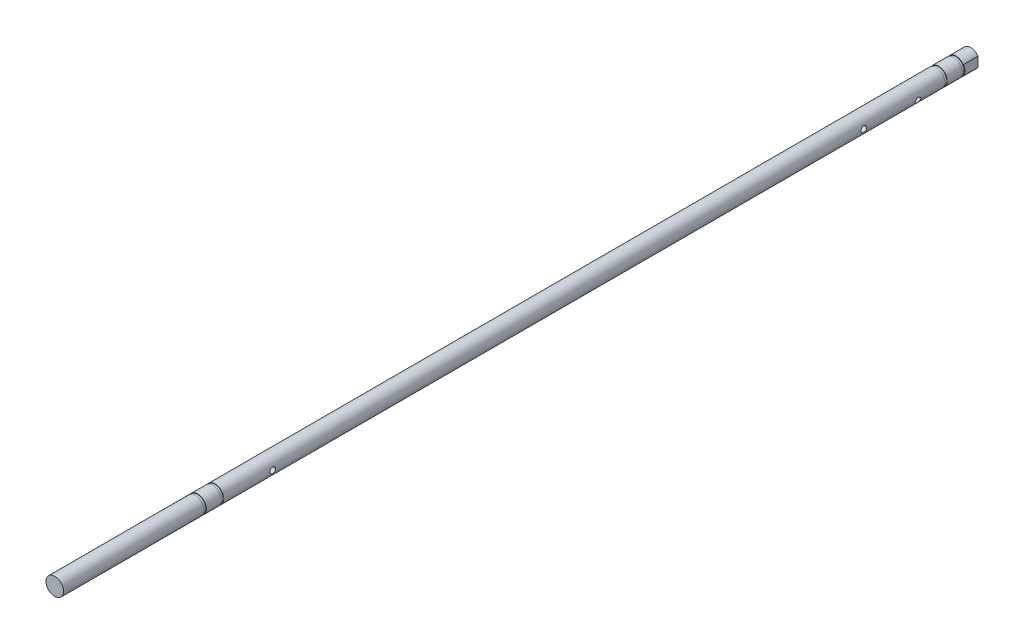
from build123d import *

# Parameters (mm, degrees)
SKETCH1_R                                  = 3
BOSS_EXTRUDE1_DEPTH                        = 275
SKETCH3_W                                  = 0.8
SKETCH3_H                                  = 0.5
CUT_EXTRUDE2_DEPTH                         = 276.032725326
CUT_EXTRUDE2_DEPTH_BACK                    = 276.032725326
SKETCH4_W                                  = 3.470061058
SKETCH4_H                                  = 7
SKETCH4_W_2                                = 2.92528695
CHAMFER1_SIZE                              = 0.3
RETAINING_GROOVES_D5P7_1_START             = 7.05
SKETCH5_R                                  = 2.85
SKETCH5_R_2                                = 2.49
RETAINING_GROOVES_D5P7_1_DEPTH             = 0.8
RETAINING_GROOVES_D5P7_2_START             = 13
SKETCH6_R                                  = 2.85
SKETCH6_R_2                                = 2.49
RETAINING_GROOVES_D5P7_2_DEPTH             = 0.8
RETAINING_GROOVES_D5P7_3_START             = 260.25
SKETCH7_R                                  = 2.85
SKETCH7_R_2                                = 2.49
RETAINING_GROOVES_D5P7_3_DEPTH             = 0.8
RETAINING_GROOVES_D5P7_4_START             = 266.2
SKETCH8_R                                  = 2.85
SKETCH8_R_2                                = 2.49
RETAINING_GROOVES_D5P7_4_DEPTH             = 0.8
TWO_HUB_CROSS_PIN_D2_DEPTH                 = 276.032725326
TWO_HUB_CROSS_PIN_D2_DEPTH_BACK            = 276.032725326
SKETCH9_R                                  = 1
SKETCH10_R                                 = 3.1
REVB_LOWER_SHAFT_NOSE_CLEARANCE_2MM_DEPTH  = 2
REVB_OLDHAM_D2_DRIVE_PIN_CLOCKED_HOLE_OU_W = 1
REVB_OLDHAM_D2_DRIVE_PIN_CLOCKED_HOLE_OU_H = 6.000106441
BENCH_ONEPIECE_SHAFT_END_TO315_START       = 275
SKETCH11_R                                 = 3
BENCH_ONEPIECE_SHAFT_END_TO315_DEPTH       = 40


# Read off the part's stored shape, not the designer's step: RevB_Oldham_D2_Drive_Pin_Clocked_Hole
with BuildPart() as part:
    # Sketch1 → Boss-Extrude1 (new body)
    with BuildSketch(Plane.XY):
        Circle(SKETCH1_R)
    extrude(amount=BOSS_EXTRUDE1_DEPTH)

    # Sketch3 → Cut-Revolve1 (revolve, cut)
    with BuildSketch(Plane(origin=(0, 0, 0), x_dir=(0, 0, -1), z_dir=(1, 0, 0)), mode=Mode.PRIVATE) as cut_revolve1_sk:
        with Locations((-266.6, 2.75)):
            Rectangle(SKETCH3_W, SKETCH3_H)
        with Locations((-260.65, 2.75)):
            Rectangle(SKETCH3_W, SKETCH3_H)
        with Locations((-13.4, 2.75)):
            Rectangle(SKETCH3_W, SKETCH3_H)
        with Locations((-7.45, 2.75)):
            Rectangle(SKETCH3_W, SKETCH3_H)
    revolve(cut_revolve1_sk.sketch.rotate(Axis((0, 0, 263.365004794), (0, 0, -1)), 90), axis=Axis((0, 0, 263.365004794), (0, 0, -1)), mode=Mode.SUBTRACT)

    # Sketch4 → Cut-Extrude2 (cut, two sides: drawn at the far end of the back side and taken through both)
    with BuildSketch(Plane(origin=(0, 0, 0), x_dir=(1, 0, 0), z_dir=(0, 1, 0)).offset(-CUT_EXTRUDE2_DEPTH_BACK)):
        with Locations((4.235030529, -3.5)):
            Rectangle(SKETCH4_W, SKETCH4_H)
        with Locations((-3.962643475, -3.5)):
            Rectangle(SKETCH4_W_2, SKETCH4_H)
    extrude(amount=CUT_EXTRUDE2_DEPTH + CUT_EXTRUDE2_DEPTH_BACK, mode=Mode.SUBTRACT)

    # Chamfer1
    chamfer1_edges = [part.edges().sort_by_distance(p)[0] for p in [
        (0, 3, 0),
        (0, -3, 0),
    ]]
    chamfer(chamfer1_edges, length=CHAMFER1_SIZE)

    # Sketch5 → Retaining_Grooves_D5p7_1 (add)
    with BuildSketch(Plane.XY.offset(RETAINING_GROOVES_D5P7_1_START)):
        Circle(SKETCH5_R)
        Circle(SKETCH5_R_2, mode=Mode.SUBTRACT)
    extrude(amount=RETAINING_GROOVES_D5P7_1_DEPTH)

    # Sketch6 → Retaining_Grooves_D5p7_2 (add)
    with BuildSketch(Plane.XY.offset(RETAINING_GROOVES_D5P7_2_START)):
        Circle(SKETCH6_R)
        Circle(SKETCH6_R_2, mode=Mode.SUBTRACT)
    extrude(amount=RETAINING_GROOVES_D5P7_2_DEPTH)

    # Sketch7 → Retaining_Grooves_D5p7_3 (add)
    with BuildSketch(Plane.XY.offset(RETAINING_GROOVES_D5P7_3_START)):
        Circle(SKETCH7_R)
        Circle(SKETCH7_R_2, mode=Mode.SUBTRACT)
    extrude(amount=RETAINING_GROOVES_D5P7_3_DEPTH)

    # Sketch8 → Retaining_Grooves_D5p7_4 (add)
    with BuildSketch(Plane.XY.offset(RETAINING_GROOVES_D5P7_4_START)):
        Circle(SKETCH8_R)
        Circle(SKETCH8_R_2, mode=Mode.SUBTRACT)
    extrude(amount=RETAINING_GROOVES_D5P7_4_DEPTH)

    # Sketch9 → Two_Hub_Cross_Pin_D2 (cut, two sides: drawn at the far end of the back side and taken through both)
    with BuildSketch(Plane(origin=(0, 0, 0), x_dir=(0, 0, -1), z_dir=(1, 0, 0)).offset(-TWO_HUB_CROSS_PIN_D2_DEPTH_BACK)):
        with Locations((-41.5, 0)):
            Circle(SKETCH9_R)
        with Locations((-243.5, 0)):
            Circle(SKETCH9_R)
    extrude(amount=TWO_HUB_CROSS_PIN_D2_DEPTH + TWO_HUB_CROSS_PIN_D2_DEPTH_BACK, mode=Mode.SUBTRACT)

    # Sketch10 → RevB_Lower_Shaft_Nose_Clearance_2mm (cut)
    with BuildSketch(Plane(origin=(0, 0, 0), x_dir=(-1, 0, 0), z_dir=(0, 0, -1))):
        Circle(SKETCH10_R)
    extrude(amount=-REVB_LOWER_SHAFT_NOSE_CLEARANCE_2MM_DEPTH, mode=Mode.SUBTRACT)

    # RevB_Oldham_D2_Drive_Pin_Clocked_Hole ou → RevB_Oldham_D2_Drive_Pin_Clocked_Hole (revolve, cut)
    with BuildSketch(Plane(origin=(0, 0, 22.925), x_dir=(0.2727065426398811, 0.962097262027807, 0), z_dir=(0, 0, -1))):
        with Locations((0.5, 2.6843e-05)):
            Rectangle(REVB_OLDHAM_D2_DRIVE_PIN_CLOCKED_HOLE_OU_W, REVB_OLDHAM_D2_DRIVE_PIN_CLOCKED_HOLE_OU_H)
    revolve(axis=Axis((0, 0, 22.925), (0.962097262027807, -0.2727065426398811, 0)), mode=Mode.SUBTRACT)

    # Sketch11 → Bench_OnePiece_Shaft_End_To315 (add)
    with BuildSketch(Plane.XY.offset(BENCH_ONEPIECE_SHAFT_END_TO315_START)):
        with Locations(Location((0, 0, 0), (0, 0, 213.557309762))):
            Circle(SKETCH11_R)
    extrude(amount=BENCH_ONEPIECE_SHAFT_END_TO315_DEPTH)


solid = part.part
